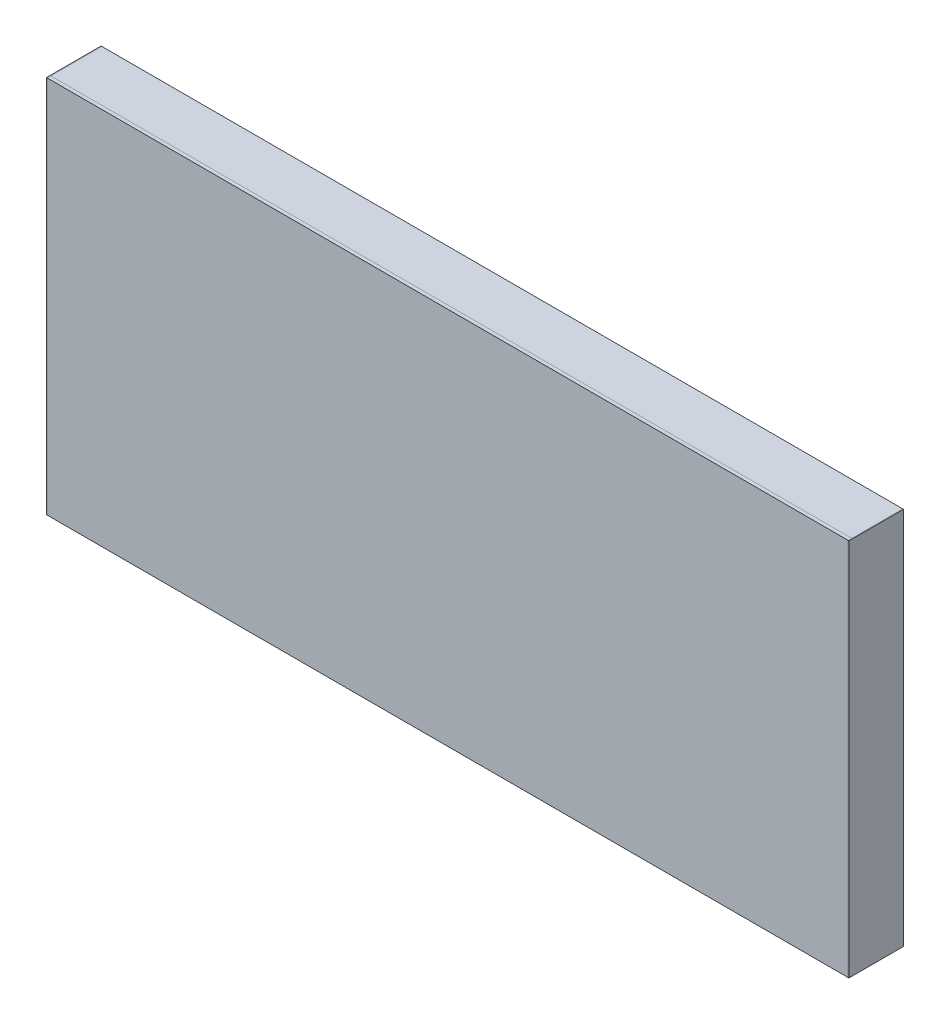
from build123d import *

# Parameters (mm, degrees)
SKETCH_1_W            = 1100
SKETCH_1_H            = 520
EXTRUDE_1_DEPTH       = 5
THICKEN_START         = -550
THICKEN_1_DEPTH       = 1100
THICKEN_START_2       = -260
THICKEN_2_OUTLINE_W   = 1100
THICKEN_2_OUTLINE_H   = 70
THICKEN_2_DEPTH       = 2
THICKEN_START_3       = -258
THICKEN_2_2_OUTLINE_W = 1100
THICKEN_2_2_OUTLINE_H = 2
THICKEN_2_2_DEPTH     = 38
EXTRUDE_2_DEPTH       = 1
SCALE_1_SCALE         = 0.6


# Read off the part's stored shape, not the designer's step: 加厚1, 加厚2
with BuildPart() as part:
    # 草图1 → 凸台-拉伸1 (new body)
    with BuildSketch(Plane.XY):
        Rectangle(SKETCH_1_W, SKETCH_1_H)
    extrude(amount=EXTRUDE_1_DEPTH)

    # 加厚2 outline → 加厚2 (add)
    with BuildSketch(Plane(origin=(0, 0, 0), x_dir=(1, 0, 0), z_dir=(0, 1, 0)).offset(THICKEN_START_2)):
        with Locations((0, 35)):
            Rectangle(THICKEN_2_OUTLINE_W, THICKEN_2_OUTLINE_H)
    extrude(amount=THICKEN_2_DEPTH)

    # Thicken 2 2 outline → Thicken 2 2 (add)
    with BuildSketch(Plane(origin=(0, 0, 0), x_dir=(1, 0, 0), z_dir=(0, 1, 0)).offset(THICKEN_START_3)):
        with Locations((0, 69)):
            Rectangle(THICKEN_2_2_OUTLINE_W, THICKEN_2_2_OUTLINE_H)
    extrude(amount=THICKEN_2_2_DEPTH)


with BuildPart() as body_2:
    # 加厚1 outline → 加厚1 (new body)
    with BuildSketch(Plane.YZ.offset(THICKEN_START)):
        Polygon((260, -70), (260, 0), (258, 0), (258, -68), (220, -68), (220, -70), align=None)
    extrude(amount=THICKEN_1_DEPTH)


with BuildPart() as body_3:
    # 草图4 → 凸台-拉伸2 (new body)
    with BuildSketch(Plane(origin=(550, 0, 0), x_dir=(0, 0, -1), z_dir=(1, 0, 0))):
        Polygon((0, 260), (70, 260), (70, 220), (70, -220), (70, -260), (-5, -260), (-5, 260), align=None)
    extrude(amount=EXTRUDE_2_DEPTH)


with BuildPart() as body_4:
    # 镜向2: mirrored copy
    add(body_3.part.mirror(Plane(origin=(0, 0, 0), x_dir=(0, 0, 1), z_dir=(1, 0, 0))))


with BuildPart() as body_2_1:
    # 缩放比例1: scaled about (0, 0, 0)
    add(body_2.part.scale(SCALE_1_SCALE))


with BuildPart() as body_3_1:
    # 缩放比例1: scaled about (0, 0, 0)
    add(body_3.part.scale(SCALE_1_SCALE))


with BuildPart() as part_1:
    # 缩放比例1: scaled about (0, 0, 0)
    add(part.part.scale(SCALE_1_SCALE))


with BuildPart() as body_4_1:
    # 缩放比例1: scaled about (0, 0, 0)
    add(body_4.part.scale(SCALE_1_SCALE))


solid = Compound([body_2_1.part, body_3_1.part, part_1.part, body_4_1.part])
